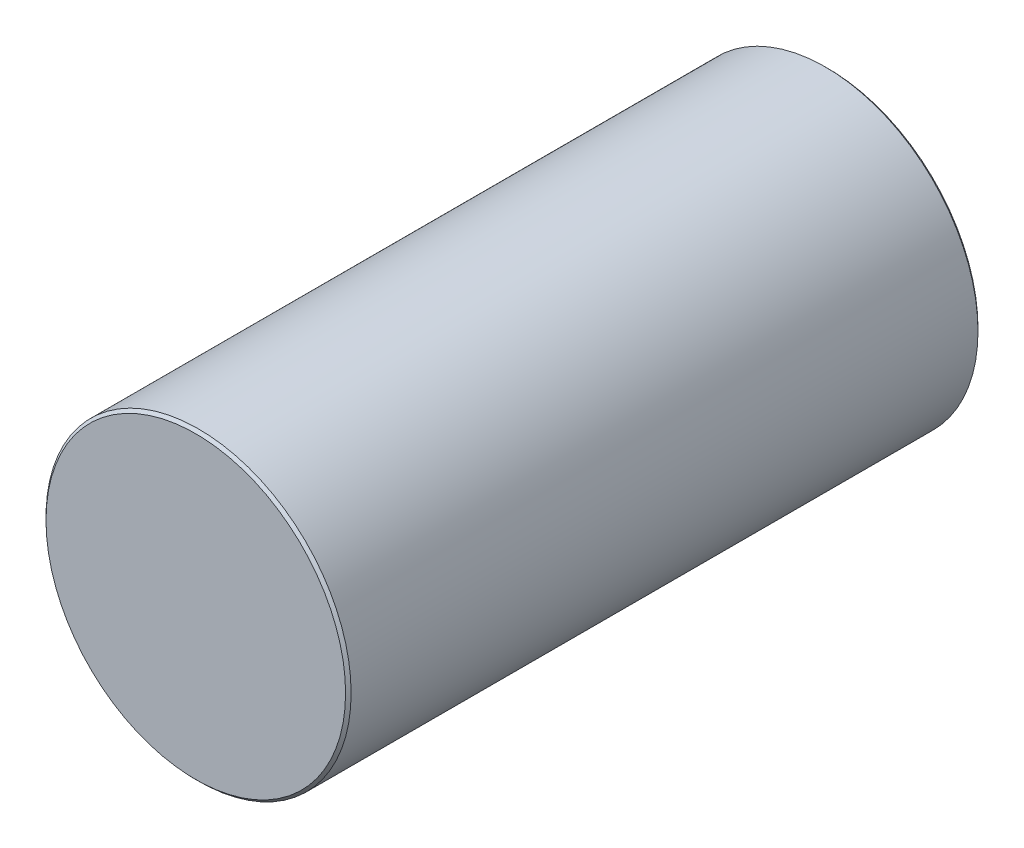
from build123d import *

# Parameters (mm, degrees)
SKETCH2_R           = 2.75
BOSS_EXTRUDE1_DEPTH = 11.4
CHAMFER2_SIZE       = 0.05


with BuildPart() as part:
    # Sketch2 → Boss-Extrude1 (new body)
    with BuildSketch(Plane.XY):
        Circle(SKETCH2_R)
    extrude(amount=BOSS_EXTRUDE1_DEPTH)

    # Chamfer2
    chamfer2_edges = [part.edges().sort_by_distance(p)[0] for p in [
        (-2.75, 0, 11.4),
        (-2.75, 0, 0),
    ]]
    chamfer(chamfer2_edges, length=CHAMFER2_SIZE)


solid = part.part
